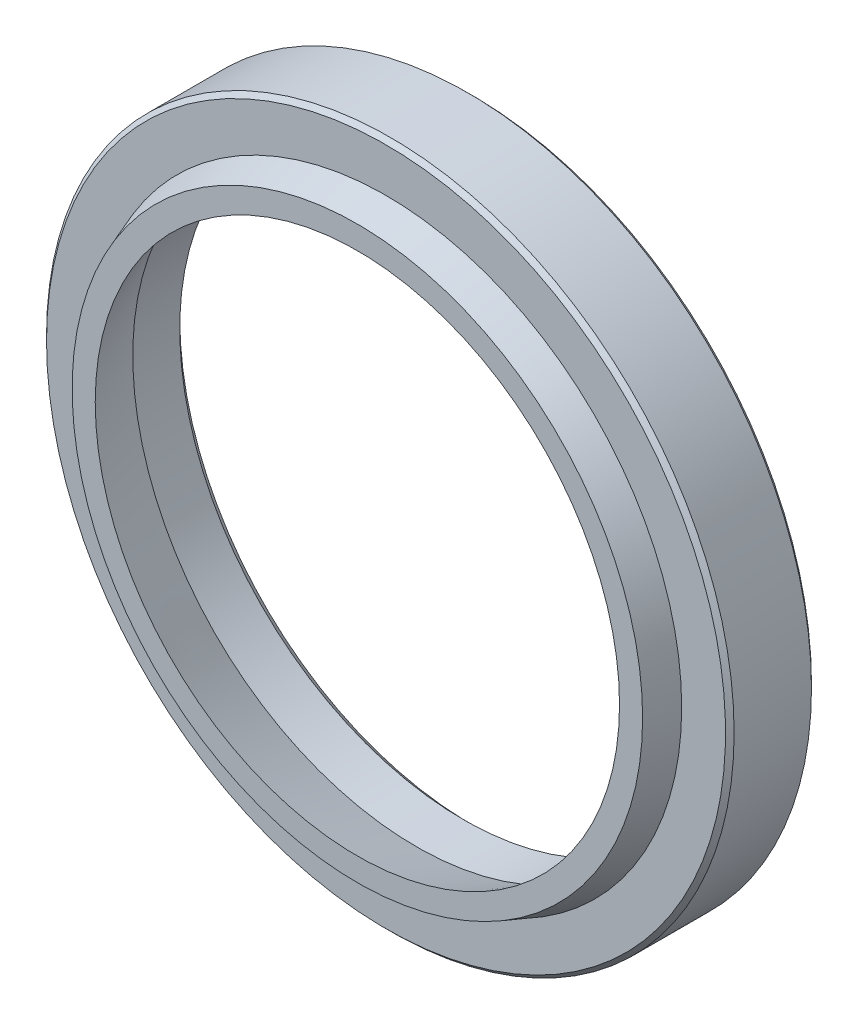
from build123d import *

# Parameters (mm, degrees)
ENDCHAMFER_SIZE  = 0.5
BODYCHAMFER_SIZE = 0.25


with BuildPart() as part:
    # Sketch1 → Body (revolve)
    with BuildSketch(Plane(origin=(0, 0, 0), x_dir=(-1, 0, 0), z_dir=(0, 1, 0))):
        Polygon((16.5, -6.666666667), (16.5, -3.434346774), (15.25, 0), (16.593382943, 0), (17.2, -1.666666667), (20, -1.666666667), (20, -6.666666667), align=None)
    revolve(axis=Axis((0, 0, 9.195898683), (0, 0, -1)))

    # EndChamfer
    endchamfer_edges = [part.edges().sort_by_distance(p)[0] for p in [
        (16.5, 0, -6.666666667),
    ]]
    chamfer(endchamfer_edges, length=ENDCHAMFER_SIZE)

    # BodyChamfer
    bodychamfer_edges = [part.edges().sort_by_distance(p)[0] for p in [
        (20, 0, -1.666666667),
        (20, 0, -6.666666667),
    ]]
    chamfer(bodychamfer_edges, length=BODYCHAMFER_SIZE)


solid = part.part
